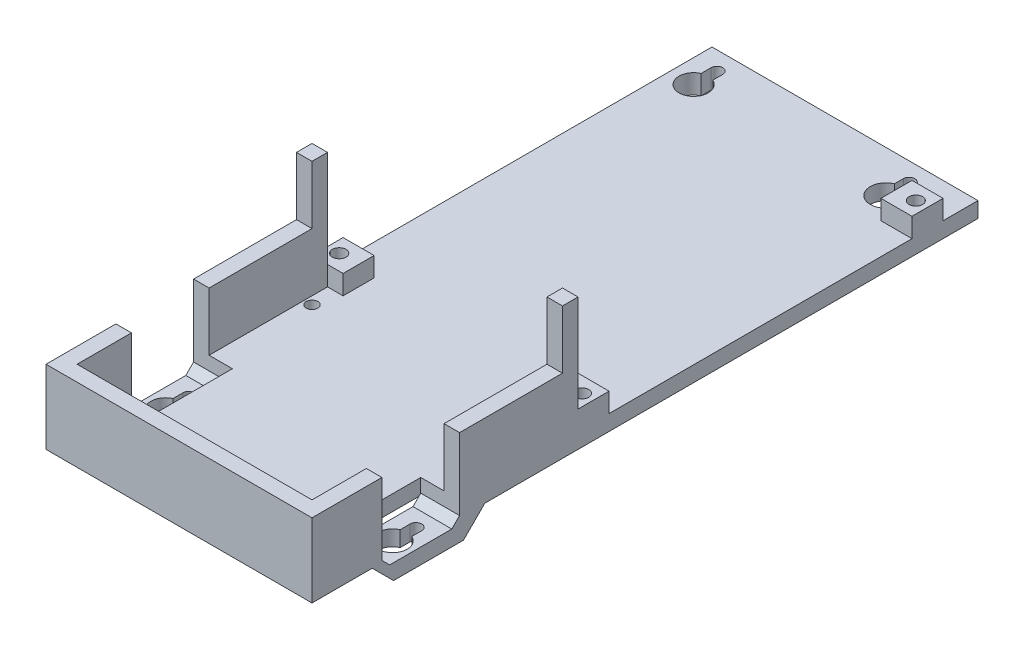
from build123d import *

# Parameters (mm, degrees)
SKETCH1_W            = 68.5
SKETCH1_H            = 64.5
BOSS_EXTRUDE3_DEPTH  = 19
SKETCH3_W            = 60.5
SKETCH3_H            = 60.5
CUT_EXTRUDE1_DEPTH   = 15
SKETCH5_W            = 68.5
SKETCH5_H            = 4
BOSS_EXTRUDE4_DEPTH  = 105
SKETCH10_W           = 10
SKETCH10_H           = 29
BOSS_EXTRUDE5_DEPTH  = 5.5
SKETCH9_W            = 4
SKETCH9_H            = 20
CUT_EXTRUDE2_DEPTH   = 20.5
SKETCH11_W           = 6
SKETCH11_H           = 20
CUT_EXTRUDE3_DEPTH   = 5.5
CHAMFER2_SIZE        = 5.5
CHAMFER3_SIZE        = 2
SKETCH12_W           = 34.25
SKETCH12_H           = 169.5
CUT_EXTRUDE4_DEPTH   = 50
SKETCH15_R           = 1.5
CUT_EXTRUDE5_DEPTH   = 50
SKETCH16_R           = 1.5
CUT_EXTRUDE6_DEPTH   = 50
SKETCH17_R           = 1.5
CUT_EXTRUDE7_DEPTH   = 50
SKETCH19_W           = 34.25
SKETCH19_H           = 4
BOSS_EXTRUDE6_DEPTH  = 2
SKETCH26_W           = 4
SKETCH26_H           = 4
BOSS_EXTRUDE7_DEPTH  = 30
SKETCH20_R           = 3.75
CUT_EXTRUDE9_DEPTH   = 179.453250181
SKETCH21_W           = 3
SKETCH21_H           = 2.563068229
CUT_EXTRUDE10_DEPTH  = 5
SKETCH18_R           = 1.5
CUT_EXTRUDE8_DEPTH   = 135
SKETCH24_R           = 4
CUT_EXTRUDE13_DEPTH  = 178.441011325
SKETCH25_W           = 3
SKETCH25_H           = 2.291900756
CUT_EXTRUDE14_DEPTH  = 5
SKETCH27_R           = 1.75
CUT_EXTRUDE15_DEPTH  = 178.441011325
BOSS_EXTRUDE9_START  = 5
SKETCH30_W           = 8
SKETCH30_H           = 8
SKETCH30_R           = 1.75
BOSS_EXTRUDE9_DEPTH  = 5
SKETCH31_W           = 8
SKETCH31_H           = 8
CUT_EXTRUDE16_DEPTH  = 5
SKETCH32_W           = 19.705511252
SKETCH32_H           = 17.257631466
BOSS_EXTRUDE10_DEPTH = 5
SKETCH33_R           = 1.5
CUT_EXTRUDE17_DEPTH  = 5
SKETCH34_R           = 3.75
CUT_EXTRUDE18_DEPTH  = 5
SKETCH35_W           = 3
SKETCH35_H           = 2.563068229
CUT_EXTRUDE19_DEPTH  = 5


# Some blends are built 0.0001 mm under size
with BuildPart() as part:
    # Sketch1 → Boss-Extrude3 (new body)
    with BuildSketch(Plane(origin=(0, 0, 0), x_dir=(1, 0, 0), z_dir=(0, 1, 0))):
        with Locations((-34.25, 32.25)):
            Rectangle(SKETCH1_W, SKETCH1_H)
    extrude(amount=BOSS_EXTRUDE3_DEPTH)

    # Sketch3 → Cut-Extrude1 (cut)
    with BuildSketch(Plane(origin=(0, 19, 0), x_dir=(1, 0, 0), z_dir=(0, 1, 0))):
        with Locations((-34.25, 34.25)):
            Rectangle(SKETCH3_W, SKETCH3_H)
    extrude(amount=-CUT_EXTRUDE1_DEPTH, mode=Mode.SUBTRACT)

    # Sketch5 → Boss-Extrude4 (add)
    with BuildSketch(Plane(origin=(0, 0, -64.5), x_dir=(-1, 0, 0), z_dir=(0, 0, -1))):
        with Locations((34.25, 2)):
            Rectangle(SKETCH5_W, SKETCH5_H)
    extrude(amount=BOSS_EXTRUDE4_DEPTH)

    # Sketch10 → Boss-Extrude5 (add)
    with BuildSketch(Plane.XZ):
        with Locations((-5, -30)):
            Rectangle(SKETCH10_W, SKETCH10_H)
    extrude(amount=BOSS_EXTRUDE5_DEPTH)

    # Sketch9 → Cut-Extrude2 (cut)
    with BuildSketch(Plane(origin=(0, 19, 0), x_dir=(1, 0, 0), z_dir=(0, 1, 0))):
        with Locations((-2, 28)):
            Rectangle(SKETCH9_W, SKETCH9_H)
    extrude(amount=-CUT_EXTRUDE2_DEPTH, mode=Mode.SUBTRACT)

    # Sketch11 → Cut-Extrude3 (cut)
    with BuildSketch(Plane(origin=(0, 4, 0), x_dir=(1, 0, 0), z_dir=(0, 1, 0))):
        with Locations((-7, 28)):
            Rectangle(SKETCH11_W, SKETCH11_H)
    extrude(amount=-CUT_EXTRUDE3_DEPTH, mode=Mode.SUBTRACT)

    # Chamfer2
    chamfer2_edges = [part.edges().sort_by_distance(p)[0] for p in [
        (-5, -5.5, -44.5),
        (-5, -5.5, -15.5),
    ]]
    chamfer(chamfer2_edges, length=CHAMFER2_SIZE - 0.0001)  # a hair under: the kernel refuses the full size

    # Chamfer3
    # the kernel refuses this chamfer: 2 mm, written as the material it adds along each edge
    with BuildSketch(Plane(origin=(0, -1.5, -38), x_dir=(0, 0.9996219169112968, -0.027495876610585623), z_dir=(-1, 0, 0)), Plane(origin=(0, -1.5, -18), x_dir=(0, -0.027495876610586403, -0.9996219169112968), z_dir=(-1, 0, 0))) as chamfer3_piece_1:
        Polygon((CHAMFER3_SIZE * 0.999621916911, -CHAMFER3_SIZE * 0.0274958766106), (-CHAMFER3_SIZE * 0.0274958766106, -CHAMFER3_SIZE * 0.999621916911), (0, 0), align=None)
    extrude(amount=10)

    # Sketch12 → Cut-Extrude4 (cut)
    with BuildSketch(Plane(origin=(0, 19, 0), x_dir=(1, 0, 0), z_dir=(0, 1, 0))):
        with Locations((-51.375, 84.75)):
            Rectangle(SKETCH12_W, SKETCH12_H)
    extrude(amount=-CUT_EXTRUDE4_DEPTH, mode=Mode.SUBTRACT)

    # Sketch15 → Cut-Extrude5 (cut)
    with BuildSketch(Plane(origin=(0, -1.5, 0), x_dir=(1, 0, 0), z_dir=(0, 1, 0))):
        with Locations(Location((-5, 31.75713966, 0), (0, 0, 270))):
            Circle(SKETCH15_R)
    extrude(amount=-CUT_EXTRUDE5_DEPTH, mode=Mode.SUBTRACT)

    # Sketch16 → Cut-Extrude6 (cut)
    with BuildSketch(Plane(origin=(0, 4, 0), x_dir=(1, 0, 0), z_dir=(0, 1, 0))):
        with Locations(Location((-6, 6, 0), (0, 0, 270))):
            Circle(SKETCH16_R)
    extrude(amount=-CUT_EXTRUDE6_DEPTH, mode=Mode.SUBTRACT)

    # Sketch17 → Cut-Extrude7 (cut)
    with BuildSketch(Plane(origin=(0, 4, 0), x_dir=(1, 0, 0), z_dir=(0, 1, 0))):
        with Locations(Location((-6, 62.5, 0), (0, 0, 270))):
            Circle(SKETCH17_R)
    extrude(amount=-CUT_EXTRUDE7_DEPTH, mode=Mode.SUBTRACT)

    # Sketch19 → Boss-Extrude6 (add)
    with BuildSketch(Plane(origin=(0, 0, -169.5), x_dir=(-1, 0, 0), z_dir=(0, 0, -1))):
        with Locations((17.125, 2)):
            Rectangle(SKETCH19_W, SKETCH19_H)
    extrude(amount=BOSS_EXTRUDE6_DEPTH)

    # Sketch26 → Boss-Extrude7 (add)
    with BuildSketch(Plane(origin=(0, 4, 0), x_dir=(1, 0, 0), z_dir=(0, 1, 0))):
        with Locations((-2, 66.5)):
            Rectangle(SKETCH26_W, SKETCH26_H)
    extrude(amount=BOSS_EXTRUDE7_DEPTH)

    # Sketch20 → Cut-Extrude9 (cut, through all)
    with BuildSketch(Plane(origin=(0, -1.5, 0), x_dir=(1, 0, 0), z_dir=(0, 1, 0))):
        with Locations(Location((-5, 25.75713966, 0), (0, 0, 270))):
            Circle(SKETCH20_R)
    extrude(amount=-CUT_EXTRUDE9_DEPTH, mode=Mode.SUBTRACT)

    # Sketch21 → Cut-Extrude10 (cut)
    with BuildSketch(Plane(origin=(0, -1.5, 0), x_dir=(1, 0, 0), z_dir=(0, 1, 0))):
        with Locations((-5, 30.475605546)):
            Rectangle(SKETCH21_W, SKETCH21_H)
    extrude(amount=-CUT_EXTRUDE10_DEPTH, mode=Mode.SUBTRACT)

    # Sketch18 → Cut-Extrude8 (cut)
    with BuildSketch(Plane(origin=(0, 4, 0), x_dir=(1, 0, 0), z_dir=(0, 1, 0))):
        with Locations(Location((-13, 166.75713966, 0), (0, 0, 270))):
            Circle(SKETCH18_R)
    extrude(amount=-CUT_EXTRUDE8_DEPTH, mode=Mode.SUBTRACT)

    # Sketch24 → Cut-Extrude13 (cut, through all)
    with BuildSketch(Plane(origin=(0, 4, 0), x_dir=(1, 0, 0), z_dir=(0, 1, 0))):
        with Locations(Location((-13, 160.75713966, 0), (0, 0, 270))):
            Circle(SKETCH24_R)
    extrude(amount=-CUT_EXTRUDE13_DEPTH, mode=Mode.SUBTRACT)

    # Sketch25 → Cut-Extrude14 (cut)
    with BuildSketch(Plane(origin=(0, 4, 0), x_dir=(1, 0, 0), z_dir=(0, 1, 0))):
        with Locations((-13, 165.611189282)):
            Rectangle(SKETCH25_W, SKETCH25_H)
    extrude(amount=-CUT_EXTRUDE14_DEPTH, mode=Mode.SUBTRACT)

    # Sketch27 → Cut-Extrude15 (cut, through all)
    with BuildSketch(Plane(origin=(0, 4, 0), x_dir=(1, 0, 0), z_dir=(0, 1, 0))):
        with Locations(Location((-3, 72.5, 0), (0, 0, 270))):
            Circle(SKETCH27_R)
        with Locations(Location((-3, 158.5, 0), (0, 0, 270))):
            Circle(SKETCH27_R)
    extrude(amount=-CUT_EXTRUDE15_DEPTH, mode=Mode.SUBTRACT)

    # Sketch30 → Boss-Extrude9 (add)
    # profile 1 of 2: a face of its own
    with BuildSketch(Plane(origin=(0, 4, 0), x_dir=(1, 0, 0), z_dir=(0, 1, 0)).offset(BOSS_EXTRUDE9_START)):
        with Locations((-4, 72.5)):
            Rectangle(SKETCH30_W, SKETCH30_H)
        with Locations(Location((-3, 72.5, 0), (0, 0, 270))):
            Circle(SKETCH30_R, mode=Mode.SUBTRACT)
    # profile 2 of 2: a face of its own
    with BuildSketch(Plane(origin=(0, 4, 0), x_dir=(1, 0, 0), z_dir=(0, 1, 0)).offset(BOSS_EXTRUDE9_START)):
        with Locations((-4, 158.5)):
            Rectangle(SKETCH30_W, SKETCH30_H)
        with Locations(Location((-3, 158.5, 0), (0, 0, 270))):
            Circle(SKETCH30_R, mode=Mode.SUBTRACT)
    extrude(amount=-BOSS_EXTRUDE9_DEPTH)

    # Mirror5: part across plane


with BuildPart() as part_1:
    add(part.part)
    add(part.part.mirror(Plane(origin=(-34.25, 0, 0), x_dir=(0, 0, 1), z_dir=(1, 0, 0))))

    # Sketch31 → Cut-Extrude16 (cut)
    with BuildSketch(Plane(origin=(0, 9, 0), x_dir=(1, 0, 0), z_dir=(0, 1, 0))):
        with Locations((-64.5, 158.5)):
            Rectangle(SKETCH31_W, SKETCH31_H)
    extrude(amount=-CUT_EXTRUDE16_DEPTH, mode=Mode.SUBTRACT)

    # Sketch32 → Boss-Extrude10 (add)
    with BuildSketch(Plane(origin=(0, 4, 0), x_dir=(1, 0, 0), z_dir=(0, 1, 0))):
        with Locations((-58.647244374, 162.871184267)):
            Rectangle(SKETCH32_W, SKETCH32_H)
    extrude(amount=-BOSS_EXTRUDE10_DEPTH)

    # Sketch33 → Cut-Extrude17 (cut)
    with BuildSketch(Plane(origin=(0, 4, 0), x_dir=(1, 0, 0), z_dir=(0, 1, 0))):
        with Locations(Location((-62.5, 166.76, 0), (0, 0, 270))):
            Circle(SKETCH33_R)
    extrude(amount=-CUT_EXTRUDE17_DEPTH, mode=Mode.SUBTRACT)

    # Sketch34 → Cut-Extrude18 (cut)
    with BuildSketch(Plane(origin=(0, 4, 0), x_dir=(1, 0, 0), z_dir=(0, 1, 0))):
        with Locations(Location((-62.5, 160.76, 0), (0, 0, 270))):
            Circle(SKETCH34_R)
    extrude(amount=-CUT_EXTRUDE18_DEPTH, mode=Mode.SUBTRACT)

    # Sketch35 → Cut-Extrude19 (cut)
    with BuildSketch(Plane(origin=(0, 4, 0), x_dir=(1, 0, 0), z_dir=(0, 1, 0))):
        with Locations((-62.5, 165.478465886)):
            Rectangle(SKETCH35_W, SKETCH35_H)
    extrude(amount=-CUT_EXTRUDE19_DEPTH, mode=Mode.SUBTRACT)


solid = part_1.part
